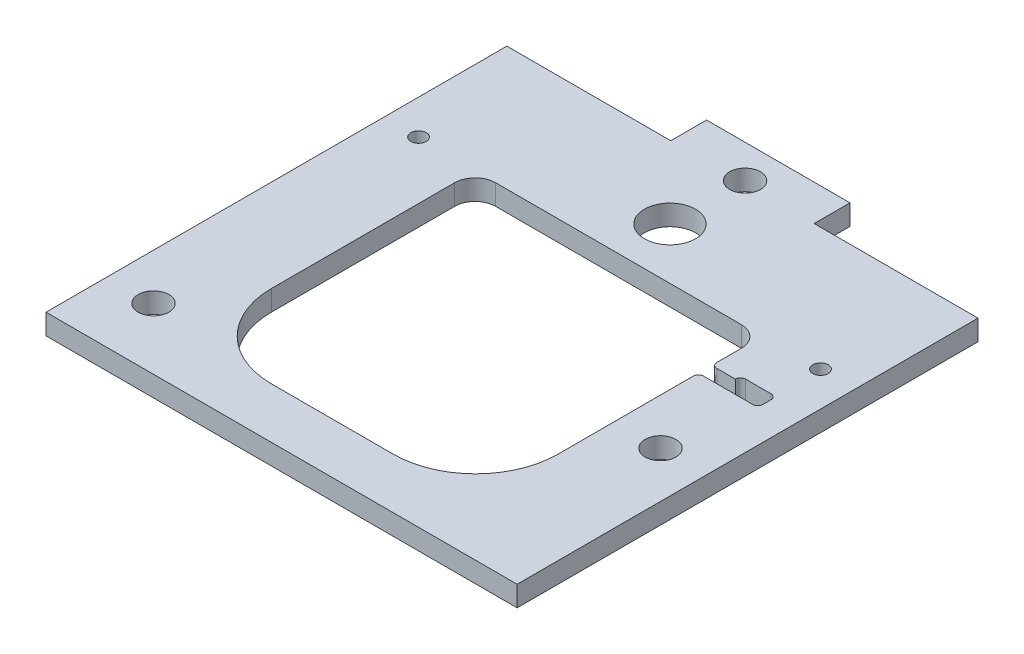
from build123d import *

# Parameters (mm, degrees)
SKETCH1_R          = 1.5
EXTRUDE1_DEPTH     = 2
CUT_EXTRUDE1_DEPTH = 2
FILLET1_R          = 2
CUT_EXTRUDE3_REACH = 55.715
SKETCH3_R          = 1.5
SKETCH3_R_2        = 0.75
SKETCH3_R_3        = 2.5
CUT_EXTRUDE4_REACH = 55.715
FILLET2_R          = 0.5


with BuildPart() as part:
    # Sketch1 → Extrude1 (new body)
    with BuildSketch(Plane(origin=(0, 0, 0), x_dir=(1, 0, 0), z_dir=(0, 1, 0))):
        Polygon((-23, 0), (23, 0), (23, 45), (7, 45), (7, 48.5), (-7, 48.5), (-7, 45), (-23, 45), align=None)
        with Locations(Location((-18.5, 6, 0), (0, 0, 270))):
            Circle(SKETCH1_R, mode=Mode.SUBTRACT)
        with Locations(Location((18.5, 18.5, 0), (0, 0, 270))):
            Circle(SKETCH1_R, mode=Mode.SUBTRACT)
    extrude(amount=EXTRUDE1_DEPTH)

    # Sketch2 → Cut-Extrude1 (cut)
    with BuildSketch(Plane(origin=(0, 2, 0), x_dir=(1, 0, 0), z_dir=(0, 1, 0))):
        with BuildLine():
            Line((-5.95, 4.95), (5.95, 4.95))
            ThreePointArc((5.95, 4.95), (11.642209589, 7.307790411), (14, 13))
            Line((14, 13), (14, 32.9))
            Line((14, 32.9), (-14, 32.9))
            Line((-14, 32.9), (-14, 13))
            ThreePointArc((-14, 13), (-11.642209589, 7.307790411), (-5.95, 4.95))
        make_face()
    extrude(amount=-CUT_EXTRUDE1_DEPTH, mode=Mode.SUBTRACT)

    # Fillet1
    fillet1_edges = [part.edges().sort_by_distance(p)[0] for p in [
        (-14, 1, -32.9),
        (14, 1, -32.9),
    ]]
    fillet(fillet1_edges, radius=FILLET1_R)

    # Sketch3 → Cut-Extrude3 (cut, up to next)
    with BuildSketch(Plane(origin=(0, 2, 0), x_dir=(1, 0, 0), z_dir=(0, 1, 0)), mode=Mode.PRIVATE) as cut_extrude3_sk1:
        with Locations(Location((0, 45.257858412, 0), (0, 0, 270))):
            Circle(SKETCH3_R)
    cut_extrude3_tool1 = extrude(cut_extrude3_sk1.sketch, amount=-CUT_EXTRUDE3_REACH, mode=Mode.PRIVATE) & part.part
    # Sketch3 → Cut-Extrude3 (cut, up to next)
    with BuildSketch(Plane(origin=(0, 2, 0), x_dir=(1, 0, 0), z_dir=(0, 1, 0)), mode=Mode.PRIVATE) as cut_extrude3_sk2:
        with Locations(Location((-19.625, 33, 0), (0, 0, 270))):
            Circle(SKETCH3_R_2)
    cut_extrude3_tool2 = extrude(cut_extrude3_sk2.sketch, amount=-CUT_EXTRUDE3_REACH, mode=Mode.PRIVATE) & part.part
    # Sketch3 → Cut-Extrude3 (cut, up to next)
    with BuildSketch(Plane(origin=(0, 2, 0), x_dir=(1, 0, 0), z_dir=(0, 1, 0)), mode=Mode.PRIVATE) as cut_extrude3_sk3:
        with Locations(Location((19.625, 33, 0), (0, 0, 270))):
            Circle(SKETCH3_R_2)
    cut_extrude3_tool3 = extrude(cut_extrude3_sk3.sketch, amount=-CUT_EXTRUDE3_REACH, mode=Mode.PRIVATE) & part.part
    # Sketch3 → Cut-Extrude3 (cut, up to next)
    with BuildSketch(Plane(origin=(0, 2, 0), x_dir=(1, 0, 0), z_dir=(0, 1, 0)), mode=Mode.PRIVATE) as cut_extrude3_sk4:
        with Locations(Location((0, 37.925, 0), (0, 0, 270))):
            Circle(SKETCH3_R_3)
    cut_extrude3_tool4 = extrude(cut_extrude3_sk4.sketch, amount=-CUT_EXTRUDE3_REACH, mode=Mode.PRIVATE) & part.part
    add(cut_extrude3_tool1.solids().sort_by_distance((0, 2, -45.257858))[0], mode=Mode.SUBTRACT)
    add(cut_extrude3_tool2.solids().sort_by_distance((-19.625, 2, -33))[0], mode=Mode.SUBTRACT)
    add(cut_extrude3_tool3.solids().sort_by_distance((19.625, 2, -33))[0], mode=Mode.SUBTRACT)
    add(cut_extrude3_tool4.solids().sort_by_distance((0, 2, -37.925))[0], mode=Mode.SUBTRACT)

    # Sketch10 → Cut-Extrude4 (cut, up to next)
    with BuildSketch(Plane(origin=(0, 2, 0), x_dir=(1, 0, 0), z_dir=(0, 1, 0)), mode=Mode.PRIVATE) as cut_extrude4_sk1:
        Polygon((14, 26.7), (19.8, 26.7), (19.8, 28.5), (16.3, 28.5), (16.3, 28), (14, 28), align=None)
    cut_extrude4_tool1 = extrude(cut_extrude4_sk1.sketch, amount=-CUT_EXTRUDE4_REACH, mode=Mode.PRIVATE) & part.part
    add(cut_extrude4_tool1.solids().sort_by_distance((17.116631, 2, -27.519537))[0], mode=Mode.SUBTRACT)

    # Fillet2
    fillet2_edges = [part.edges().sort_by_distance(p)[0] for p in [
        (16.3, 1, -28.5),
        (19.8, 1, -28.5),
        (19.8, 1, -26.7),
        (14, 1, -28),
        (14, 1, -26.7),
    ]]
    fillet(fillet2_edges, radius=FILLET2_R - 0.0001)  # a hair under: the kernel refuses the full size


solid = part.part
